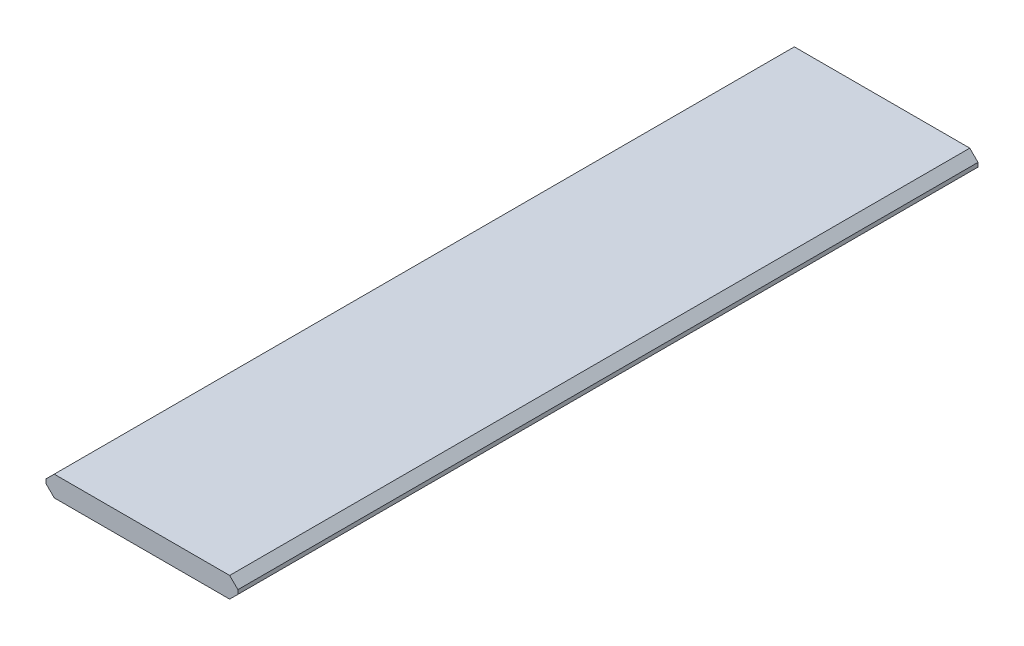
from build123d import *

# Parameters (mm, degrees)
SKETCH1_W           = 177.8
SKETCH1_H           = 685.8
BOSS_EXTRUDE1_DEPTH = 19.05
CHAMFER1_SIZE       = 7.62


with BuildPart() as part:
    # Sketch1 → Boss-Extrude1 (new body)
    with BuildSketch(Plane(origin=(0, 0, 0), x_dir=(1, 0, 0), z_dir=(0, 1, 0))):
        Rectangle(SKETCH1_W, SKETCH1_H)
    extrude(amount=BOSS_EXTRUDE1_DEPTH)

    # Chamfer1
    chamfer1_edges = [part.edges().sort_by_distance(p)[0] for p in [
        (-88.9, 19.05, 0),
        (-88.9, 0, 0),
        (88.9, 0, 0),
        (88.9, 19.05, 0),
    ]]
    chamfer(chamfer1_edges, length=CHAMFER1_SIZE)


solid = part.part
